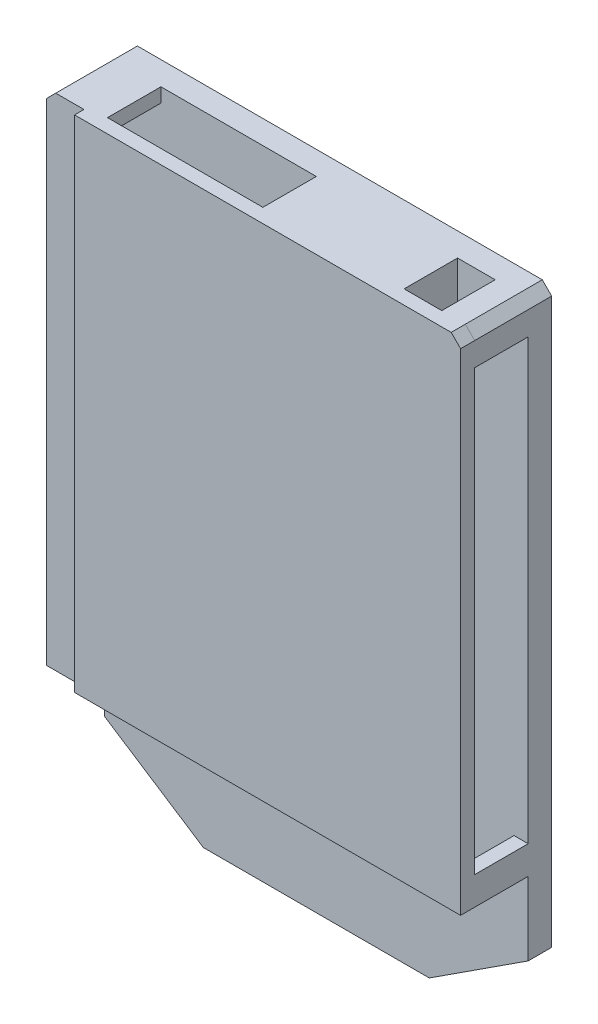
from build123d import *

# Parameters (mm, degrees)
BOSS_EXTRUDE1_DEPTH = 5
CHAMFER1_SIZE       = 2
SKETCH4_W           = 12
SKETCH4_H           = 3
BOSS_EXTRUDE2_DEPTH = 11.35
BOSS_EXTRUDE3_DEPTH = 3
BOSS_EXTRUDE4_DEPTH = 11.35
CHAMFER2_START      = 116.672618896
CHAMFER2_OUTLINE_W  = 5
CHAMFER2_OUTLINE_H  = 4.65
CHAMFER2_DEPTH      = 2.327381104
CUT_EXTRUDE2_DEPTH  = 2


with BuildPart() as part:
    # Sketch2 → Boss-Extrude1 (new body)
    with BuildSketch(Plane.XY):
        Polygon((-45, 122), (-45, 0.197559457), (-24, -13.44), (24, -13.44), (45, 0.197559457), (45, 122), align=None)
    extrude(amount=BOSS_EXTRUDE1_DEPTH)

    # Chamfer1
    chamfer1_edges = [part.edges().sort_by_distance(p)[0] for p in [
        (45, 122, 2.5),
        (-45, 122, 2.5),
    ]]
    chamfer(chamfer1_edges, length=CHAMFER1_SIZE)

    # Sketch4 → Boss-Extrude2 (add)
    with BuildSketch(Plane.XY.offset(5)):
        Polygon((-45, 120), (-43, 122), (-33, 122), (-33, 119), (-41.757359313, 119), (-42, 118.757359313), (-45, 118.757359313), align=None)
        with Locations((-39, 17.257359313)):
            Rectangle(SKETCH4_W, SKETCH4_H)
        Polygon((0, 122), (30, 122), (30, 108), (27, 108), (27, 119), (0, 119), align=None)
        Polygon((0, 15.757359313), (30, 15.757359313), (30, 29.757359313), (27, 29.757359313), (27, 18.757359313), (0, 18.757359313), align=None)
    extrude(amount=BOSS_EXTRUDE2_DEPTH)

    # Sketch5 → Boss-Extrude3 (add)
    with BuildSketch(Plane.XY.offset(16.35)):
        Polygon((45, 15.757359313), (-45, 15.757359313), (-45, 120), (-43, 122), (45, 122), align=None)
    extrude(amount=BOSS_EXTRUDE3_DEPTH)

    # Sketch6 → Boss-Extrude4 (add)
    with BuildSketch(Plane.XY.offset(5)):
        Polygon((38, 122), (43, 122), (45, 120), (45, 115), (42, 115), (42, 118.757359313), (41.757359313, 119), (38, 119), align=None)
        Polygon((45, 15.757359313), (39, 15.757359313), (39, 18.757359313), (42, 18.757359313), (42, 21.757359313), (45, 21.757359313), align=None)
    extrude(amount=BOSS_EXTRUDE4_DEPTH)

    # Chamfer2: read off the stored shape, not the designer's step
    # Chamfer2 outline → Chamfer2 (cut)
    with BuildSketch(Plane(origin=(0, 0, 0), x_dir=(0.70710678118655, -0.707106781186545, 0), z_dir=(0.707106781186545, 0.70710678118655, 0)).offset(CHAMFER2_START)):
        with Locations((-54.5, -18.675)):
            Rectangle(CHAMFER2_OUTLINE_W, CHAMFER2_OUTLINE_H)
    extrude(amount=CHAMFER2_DEPTH, mode=Mode.SUBTRACT)

    # Sketch8 → Cut-Extrude2 (cut)
    with BuildSketch(Plane.XY.offset(19.35)):
        Polygon((-45, 15.757359313), (-37, 15.757359313), (-37, 122), (-43, 122), (-45, 120), align=None)
    extrude(amount=-CUT_EXTRUDE2_DEPTH, mode=Mode.SUBTRACT)


solid = part.part
